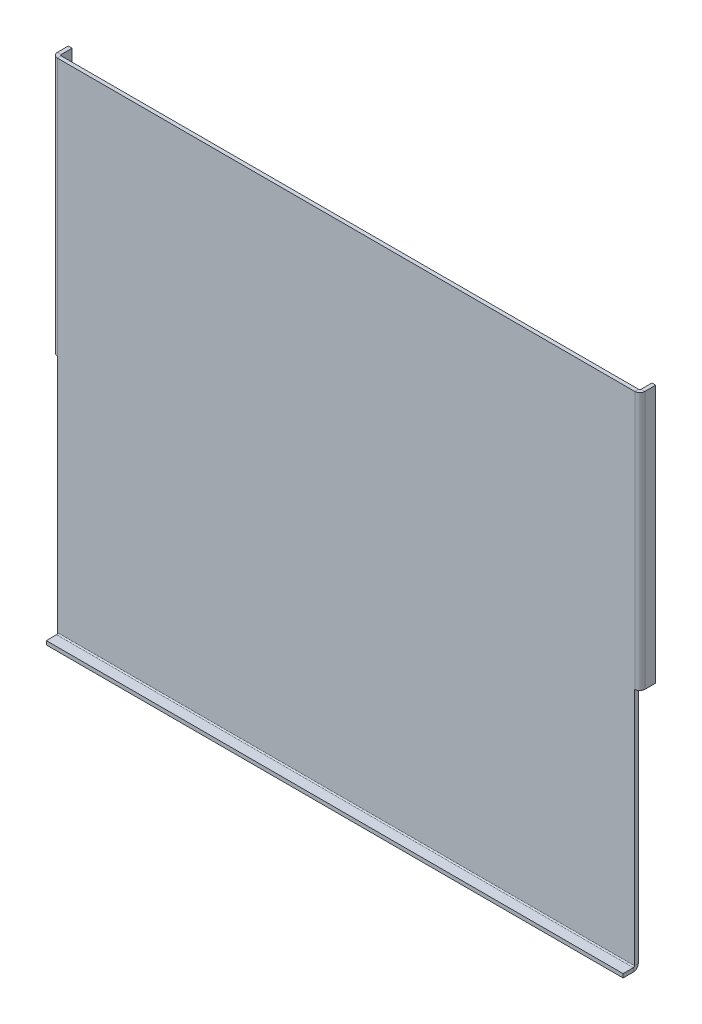
from build123d import *

# Parameters (mm, degrees)
SKETCH1_W                    = 482.6
SKETCH1_H                    = 420.37
BASE_FLANGE1_DEPTH           = 3.175
EDGE_FLANGE1_STRIP_W         = 14.7
EDGE_FLANGE1_STRIP_H         = 3.175
EDGE_FLANGE1_STRIP_CUT_DEPTH = 482.6
EDGE_FLANGE1_DEPTH           = 482.6
EDGE_FLANGE3_DEPTH           = 215.9


# Sheet-metal steps are written as plain solids
with BuildPart() as part:
    # Sketch1 → Base-Flange1 (new body)
    with BuildSketch(Plane.XY):
        Rectangle(SKETCH1_W, SKETCH1_H)
    extrude(amount=-BASE_FLANGE1_DEPTH)

    # Edge-Flange1 strip (across the edge) → Edge-Flange1 strip cut (cut)
    with BuildSketch(Plane(origin=(-241.3, -210.185, 0), x_dir=(0, 1, 0), z_dir=(1, 0, 0))):
        with Locations((-3.175, -1.5875)):
            Rectangle(EDGE_FLANGE1_STRIP_W, EDGE_FLANGE1_STRIP_H)
    extrude(amount=EDGE_FLANGE1_STRIP_CUT_DEPTH, mode=Mode.SUBTRACT)

    # Edge-Flange1 section (across the edge) → Edge-Flange1 (add)
    with BuildSketch(Plane(origin=(-241.3, -210.185, 0), x_dir=(0, 1, 0), z_dir=(1, 0, 0))):
        with BuildLine():
            Line((0, 1), (0, 9.525))
            Line((0, 9.525), (3.175, 9.525))
            Line((3.175, 9.525), (3.175, 1))
            ThreePointArc((3.175, 1), (3.467893219, 0.292893219), (4.175, 0))
            Line((4.175, 0), (4.175, -3.175))
            ThreePointArc((4.175, -3.175), (1.222829189, -1.952170811), (0, 1))
        make_face()
    extrude(amount=EDGE_FLANGE1_DEPTH)

    # Edge-Flange3 section (across the edge) → Edge-Flange3 (add)
    with BuildSketch(Plane(origin=(242.57, 210.185, -3.175), x_dir=(-1, 0, 0), z_dir=(0, -1, 0))):
        with BuildLine():
            Line((-3.175, 1), (-3.175, 10.120953567))
            Line((-3.175, 10.120953567), (0, 10.120953567))
            Line((0, 10.120953567), (0, 1))
            ThreePointArc((0, 1), (0.292893219, 0.292893219), (1, 0))
            Line((1, 0), (1.27, 0))
            Line((1.27, 0), (1.27, -3.175))
            Line((1.27, -3.175), (1, -3.175))
            ThreePointArc((1, -3.175), (-1.952170811, -1.952170811), (-3.175, 1))
        make_face()
    edge_flange3 = extrude(amount=EDGE_FLANGE3_DEPTH)

    # Mirror2: Edge-Flange3 across plane
    add(edge_flange3.mirror(Plane(origin=(0, 0, 0), x_dir=(0, 0, 1), z_dir=(1, 0, 0))))


solid = part.part
